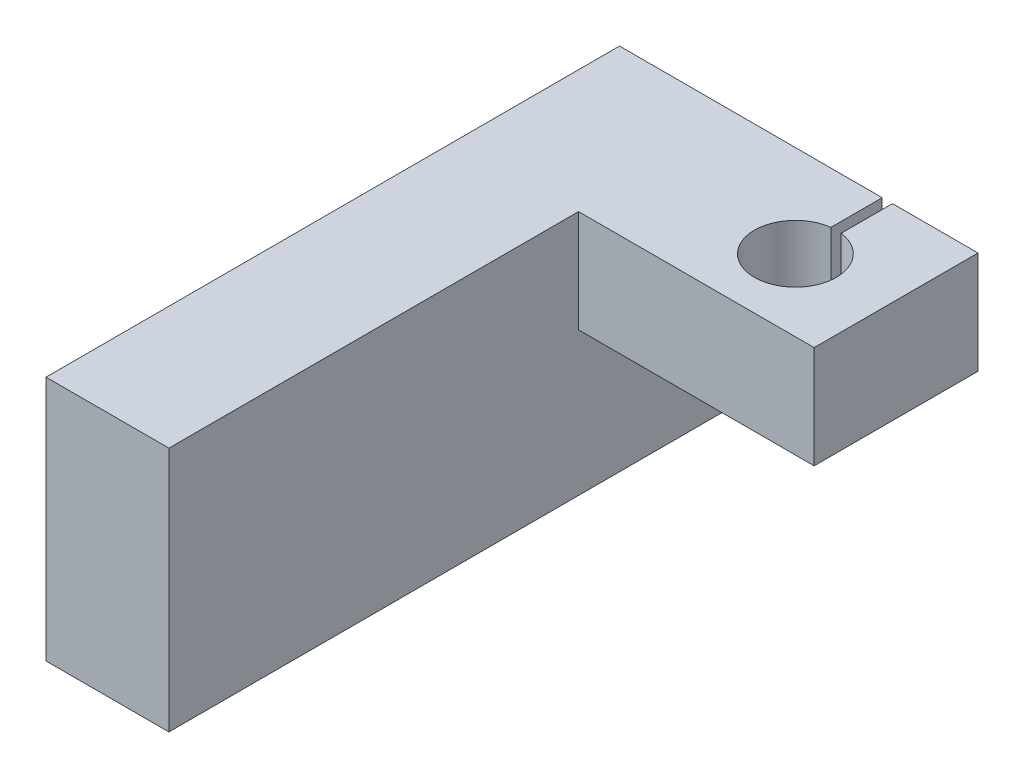
from build123d import *

# Parameters (mm, degrees)
SKETCH2_W           = 12
SKETCH2_H           = 56
BOSS_EXTRUDE1_DEPTH = 14
BOSS_EXTRUDE2_DEPTH = 10


with BuildPart() as part:
    # Sketch2 → Boss-Extrude1 (new body)
    with BuildSketch(Plane(origin=(0, 0, 0), x_dir=(1, 0, 0), z_dir=(0, 1, 0))):
        with Locations((6, -28)):
            Rectangle(SKETCH2_W, SKETCH2_H)
    extrude(amount=BOSS_EXTRUDE1_DEPTH)

    # Sketch3 → Boss-Extrude2 (add)
    with BuildSketch(Plane(origin=(0, 14, 0), x_dir=(1, 0, 0), z_dir=(0, 1, 0))):
        with BuildLine():
            Line((0, 0), (0, -56))
            Line((0, -56), (12, -56))
            Line((12, -56), (12, -16))
            Line((12, -16), (35, -16))
            Line((35, -16), (35, 0))
            Line((35, 0), (26.65, 0))
            Line((26.65, 0), (26.65, -5.011373033))
            ThreePointArc((26.65, -5.011373033), (26.15, -12.98), (25.65, -5.011373033))
            Line((25.65, -5.011373033), (25.65, 0))
            Line((25.65, 0), (0, 0))
        make_face()
    extrude(amount=BOSS_EXTRUDE2_DEPTH)


solid = part.part
